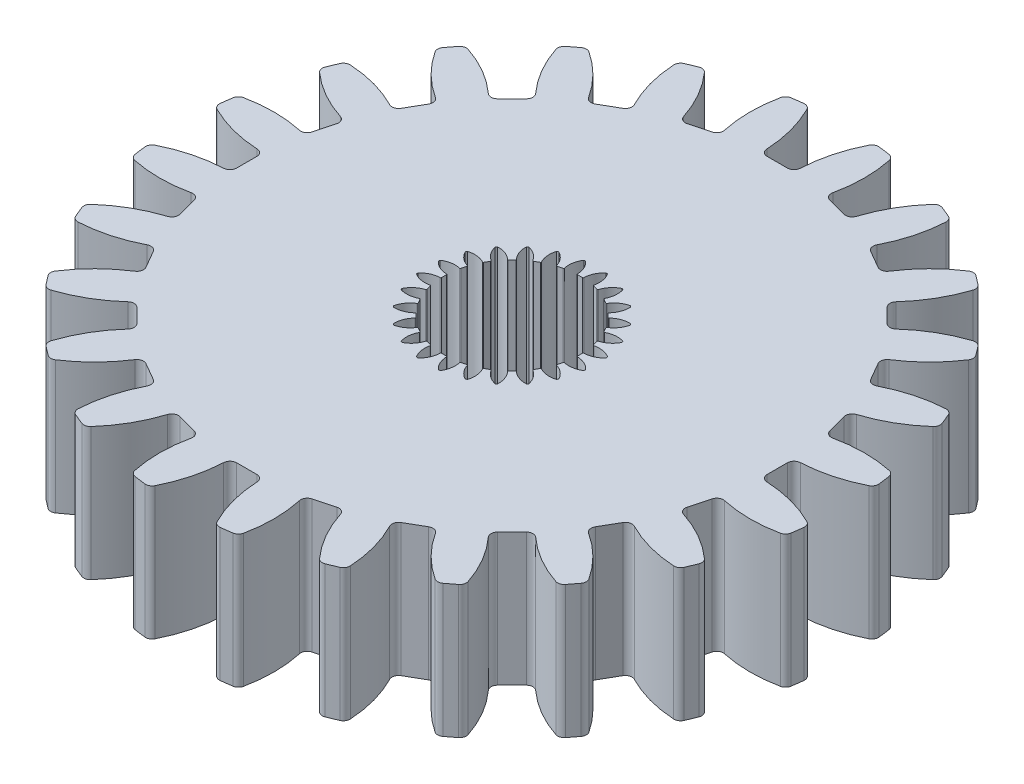
from build123d import *

# Parameters (mm, degrees)
SKETCH1_R                = 10
BOSS_EXTRUDE1_DEPTH      = 4
CUT_EXTRUDE1_START       = -10
CUT_EXTRUDE1_DEPTH       = 10
FILLET1_R                = 0.2
CIRPATTERN1_COUNT        = 24
FILLET1_OF_CIRPATTERN1_R = 0.2
SKETCH3_R                = 2.55
CUT_EXTRUDE2_DEPTH       = 10
BOSS_EXTRUDE2_DEPTH      = 4
CIRPATTERN2_DEPTH        = 4


# Read off the part's stored shape, not the designer's step: CirPattern2
with BuildPart() as part:
    # Sketch1 → Boss-Extrude1 (new body)
    with BuildSketch(Plane(origin=(0, 0, 0), x_dir=(1, 0, 0), z_dir=(0, 1, 0))):
        with Locations(Location((0, 0, 0), (0, 0, 270))):
            Circle(SKETCH1_R)
    extrude(amount=BOSS_EXTRUDE1_DEPTH)

    # Sketch2 → Cut-Extrude1 (cut)
    with BuildSketch(Plane(origin=(0, 4, 0), x_dir=(1, 0, 0), z_dir=(0, 1, 0)).offset(CUT_EXTRUDE1_START)):
        with BuildLine():
            Line((0.5, 8), (-0.5, 8))
            ThreePointArc((-0.5, 8), (-0.626989931, 9.006480261), (-1, 9.949874371))
            ThreePointArc((-1, 9.949874371), (0, 10), (1, 9.949874371))
            ThreePointArc((1, 9.949874371), (0.626989931, 9.006480261), (0.5, 8))
        make_face()
    cut_extrude1 = extrude(amount=CUT_EXTRUDE1_DEPTH, mode=Mode.SUBTRACT)

    # Fillet1
    fillet1_edges = [part.edges().sort_by_distance(p)[0] for p in [
        (1, 2, -9.949874371),
        (-1, 2, -9.949874371),
        (-0.5, 2, -8),
        (0.5, 2, -8),
    ]]
    fillet(fillet1_edges, radius=FILLET1_R)

    # CirPattern1: Cut-Extrude1 ×24 about axis
    cirpattern1_axis = Axis((0, 0, 0), (0, 1, 0))
    for i in range(1, CIRPATTERN1_COUNT):
        add(cut_extrude1.rotate(cirpattern1_axis, i * 360 / CIRPATTERN1_COUNT), mode=Mode.SUBTRACT)

    # Fillet1 of CirPattern1
    fillet1_of_cirpattern1_edges = [part.edges().sort_by_distance(p)[0] for p in [
        (-1.609291157, 2, -9.869659668),
        (-3.54114281, 2, -9.352021578),
        (-2.553515274, 2, -7.597997088),
        (-1.587589448, 2, -7.856816133),
        (-4.108911782, 2, -9.11684397),
        (-5.840962589, 2, -8.11684397),
        (-4.433012702, 2, -6.67820323),
        (-3.566987298, 2, -7.17820323),
        (-6.328516859, 2, -7.742730421),
        (-7.742730421, 2, -6.328516859),
        (-6.01040764, 2, -5.303300859),
        (-5.303300859, 2, -6.01040764),
        (-8.11684397, 2, -5.840962589),
        (-9.11684397, 2, -4.108911782),
        (-7.17820323, 2, -3.566987298),
        (-6.67820323, 2, -4.433012702),
        (-9.352021578, 2, -3.54114281),
        (-9.869659668, 2, -1.609291157),
        (-7.856816133, 2, -1.587589448),
        (-7.597997088, 2, -2.553515274),
        (-9.949874371, 2, -1),
        (-9.949874371, 2, 1),
        (-8, 2, 0.5),
        (-8, 2, -0.5),
        (-9.869659668, 2, 1.609291157),
        (-9.352021578, 2, 3.54114281),
        (-7.597997088, 2, 2.553515274),
        (-7.856816133, 2, 1.587589448),
        (-9.11684397, 2, 4.108911782),
        (-8.11684397, 2, 5.840962589),
        (-6.67820323, 2, 4.433012702),
        (-7.17820323, 2, 3.566987298),
        (-7.742730421, 2, 6.328516859),
        (-6.328516859, 2, 7.742730421),
        (-5.303300859, 2, 6.01040764),
        (-6.01040764, 2, 5.303300859),
        (-5.840962589, 2, 8.11684397),
        (-4.108911782, 2, 9.11684397),
        (-3.566987298, 2, 7.17820323),
        (-4.433012702, 2, 6.67820323),
        (-3.54114281, 2, 9.352021578),
        (-1.609291157, 2, 9.869659668),
        (-1.587589448, 2, 7.856816133),
        (-2.553515274, 2, 7.597997088),
        (-1, 2, 9.949874371),
        (1, 2, 9.949874371),
        (0.5, 2, 8),
        (-0.5, 2, 8),
        (1.609291157, 2, 9.869659668),
        (3.54114281, 2, 9.352021578),
        (2.553515274, 2, 7.597997088),
        (1.587589448, 2, 7.856816133),
        (4.108911782, 2, 9.11684397),
        (5.840962589, 2, 8.11684397),
        (4.433012702, 2, 6.67820323),
        (3.566987298, 2, 7.17820323),
        (6.328516859, 2, 7.742730421),
        (7.742730421, 2, 6.328516859),
        (6.01040764, 2, 5.303300859),
        (5.303300859, 2, 6.01040764),
        (8.11684397, 2, 5.840962589),
        (9.11684397, 2, 4.108911782),
        (7.17820323, 2, 3.566987298),
        (6.67820323, 2, 4.433012702),
        (9.352021578, 2, 3.54114281),
        (9.869659668, 2, 1.609291157),
        (7.856816133, 2, 1.587589448),
        (7.597997088, 2, 2.553515274),
        (9.949874371, 2, 1),
        (9.949874371, 2, -1),
        (8, 2, -0.5),
        (8, 2, 0.5),
        (9.869659668, 2, -1.609291157),
        (9.352021578, 2, -3.54114281),
        (7.597997088, 2, -2.553515274),
        (7.856816133, 2, -1.587589448),
        (9.11684397, 2, -4.108911782),
        (8.11684397, 2, -5.840962589),
        (6.67820323, 2, -4.433012702),
        (7.17820323, 2, -3.566987298),
        (7.742730421, 2, -6.328516859),
        (6.328516859, 2, -7.742730421),
        (5.303300859, 2, -6.01040764),
        (6.01040764, 2, -5.303300859),
        (5.840962589, 2, -8.11684397),
        (4.108911782, 2, -9.11684397),
        (3.566987298, 2, -7.17820323),
        (4.433012702, 2, -6.67820323),
        (3.54114281, 2, -9.352021578),
        (1.609291157, 2, -9.869659668),
        (1.587589448, 2, -7.856816133),
        (2.553515274, 2, -7.597997088),
    ]]
    fillet(fillet1_of_cirpattern1_edges, radius=FILLET1_OF_CIRPATTERN1_R)

    # Sketch3 → Cut-Extrude2 (cut)
    with BuildSketch(Plane(origin=(0, 4, 0), x_dir=(1, 0, 0), z_dir=(0, 1, 0))):
        with Locations(Location((0, 0, 0), (0, 0, 270))):
            Circle(SKETCH3_R)
    extrude(amount=-CUT_EXTRUDE2_DEPTH, mode=Mode.SUBTRACT)

    # Sketch4 → Boss-Extrude2 (add)
    with BuildSketch(Plane(origin=(0, 4, 0), x_dir=(1, 0, 0), z_dir=(0, 1, 0))):
        with BuildLine():
            Line((0, 2.55), (0, 2.05))
            Line((0, 2.05), (0.075298574, 2.05))
            ThreePointArc((0.075298574, 2.05), (0.089228034, 2.05564834), (0.095289661, 2.069402985))
            ThreePointArc((0.095289661, 2.069402985), (0.154666528, 2.322041158), (0.308149758, 2.531312649))
            ThreePointArc((0.308149758, 2.531312649), (0.154357937, 2.545323875), (0, 2.55))
        make_face()
        with BuildLine():
            Line((-0.075298574, 2.05), (0, 2.05))
            Line((0, 2.05), (0, 2.55))
            ThreePointArc((0, 2.55), (-0.154357937, 2.545323875), (-0.308149758, 2.531312649))
            ThreePointArc((-0.308149758, 2.531312649), (-0.154666528, 2.322041158), (-0.095289661, 2.069402985))
            ThreePointArc((-0.095289661, 2.069402985), (-0.089228034, 2.05564834), (-0.075298574, 2.05))
        make_face()
    extrude(amount=-BOSS_EXTRUDE2_DEPTH)

    # CirPattern2 outline → CirPattern2 (add)
    with BuildSketch(Plane(origin=(0, 0, 0), x_dir=(1, 0, 0), z_dir=(0, 1, 0))):
        with BuildLine():
            ThreePointArc((0.627643649, 1.974227009), (0.750384869, 2.202888881), (0.952801732, 2.365305236))
            ThreePointArc((0.952801732, 2.365305236), (0.659988565, 2.463110857), (0.357502113, 2.524815288))
            ThreePointArc((0.357502113, 2.524815288), (0.451592081, 2.282950167), (0.44355816, 2.023552567))
            ThreePointArc((0.44355816, 2.023552567), (0.445853278, 2.008697736), (0.457846205, 1.999636649))
            Line((0.457846205, 1.999636649), (0.60331188, 1.960659239))
            ThreePointArc((0.60331188, 1.960659239), (0.618228603, 1.962509907), (0.627643649, 1.974227009))
        make_face()
        with BuildLine():
            ThreePointArc((1.11722476, 1.744510725), (1.294965721, 1.933613368), (1.532521843, 2.03810618))
            ThreePointArc((1.532521843, 2.03810618), (1.275, 2.20836478), (0.998790806, 2.346255938))
            ThreePointArc((0.998790806, 2.346255938), (1.027075437, 2.088279895), (0.952178225, 1.839800386))
            ThreePointArc((0.952178225, 1.839800386), (0.950550426, 1.8248577), (0.959789522, 1.813001365))
            Line((0.959789522, 1.813001365), (1.090210478, 1.737702791))
            ThreePointArc((1.090210478, 1.737702791), (1.105097914, 1.735629667), (1.11722476, 1.744510725))
        make_face()
        with BuildLine():
            ThreePointArc((1.530668849, 1.395908918), (1.7512968, 1.532565298), (2.007803123, 1.572013556))
            ThreePointArc((2.007803123, 1.572013556), (1.803122292, 1.803122292), (1.572013556, 2.007803123))
            ThreePointArc((1.572013556, 2.007803123), (1.532565298, 1.7512968), (1.395908918, 1.530668849))
            ThreePointArc((1.395908918, 1.530668849), (1.390469133, 1.516656629), (1.396324769, 1.502813034))
            Line((1.396324769, 1.502813034), (1.502813034, 1.396324769))
            ThreePointArc((1.502813034, 1.396324769), (1.516656629, 1.390469133), (1.530668849, 1.395908918))
        make_face()
        with BuildLine():
            ThreePointArc((1.839800386, 0.952178225), (2.088279895, 1.027075437), (2.346255938, 0.998790806))
            ThreePointArc((2.346255938, 0.998790806), (2.20836478, 1.275), (2.03810618, 1.532521843))
            ThreePointArc((2.03810618, 1.532521843), (1.933613368, 1.294965721), (1.744510725, 1.11722476))
            ThreePointArc((1.744510725, 1.11722476), (1.735629667, 1.105097914), (1.737702791, 1.090210478))
            Line((1.737702791, 1.090210478), (1.813001365, 0.959789522))
            ThreePointArc((1.813001365, 0.959789522), (1.8248577, 0.950550426), (1.839800386, 0.952178225))
        make_face()
        with BuildLine():
            ThreePointArc((2.023552567, 0.44355816), (2.282950167, 0.451592081), (2.524815288, 0.357502113))
            ThreePointArc((2.524815288, 0.357502113), (2.463110857, 0.659988565), (2.365305236, 0.952801732))
            ThreePointArc((2.365305236, 0.952801732), (2.202888881, 0.750384869), (1.974227009, 0.627643649))
            ThreePointArc((1.974227009, 0.627643649), (1.962509907, 0.618228603), (1.960659239, 0.60331188))
            Line((1.960659239, 0.60331188), (1.999636649, 0.457846205))
            ThreePointArc((1.999636649, 0.457846205), (2.008697736, 0.445853278), (2.023552567, 0.44355816))
        make_face()
        with BuildLine():
            ThreePointArc((2.069402985, -0.095289661), (2.322041158, -0.154666528), (2.531312649, -0.308149758))
            ThreePointArc((2.531312649, -0.308149758), (2.55, 0), (2.531312649, 0.308149758))
            ThreePointArc((2.531312649, 0.308149758), (2.322041158, 0.154666528), (2.069402985, 0.095289661))
            ThreePointArc((2.069402985, 0.095289661), (2.05564834, 0.089228034), (2.05, 0.075298574))
            Line((2.05, 0.075298574), (2.05, -0.075298574))
            ThreePointArc((2.05, -0.075298574), (2.05564834, -0.089228034), (2.069402985, -0.095289661))
        make_face()
        with BuildLine():
            ThreePointArc((1.974227009, -0.627643649), (2.202888881, -0.750384869), (2.365305236, -0.952801732))
            ThreePointArc((2.365305236, -0.952801732), (2.463110857, -0.659988565), (2.524815288, -0.357502113))
            ThreePointArc((2.524815288, -0.357502113), (2.282950167, -0.451592081), (2.023552567, -0.44355816))
            ThreePointArc((2.023552567, -0.44355816), (2.008697736, -0.445853278), (1.999636649, -0.457846205))
            Line((1.999636649, -0.457846205), (1.960659239, -0.60331188))
            ThreePointArc((1.960659239, -0.60331188), (1.962509907, -0.618228603), (1.974227009, -0.627643649))
        make_face()
        with BuildLine():
            ThreePointArc((1.744510725, -1.11722476), (1.933613368, -1.294965721), (2.03810618, -1.532521843))
            ThreePointArc((2.03810618, -1.532521843), (2.20836478, -1.275), (2.346255938, -0.998790806))
            ThreePointArc((2.346255938, -0.998790806), (2.088279895, -1.027075437), (1.839800386, -0.952178225))
            ThreePointArc((1.839800386, -0.952178225), (1.8248577, -0.950550426), (1.813001365, -0.959789522))
            Line((1.813001365, -0.959789522), (1.737702791, -1.090210478))
            ThreePointArc((1.737702791, -1.090210478), (1.735629667, -1.105097914), (1.744510725, -1.11722476))
        make_face()
        with BuildLine():
            ThreePointArc((1.395908918, -1.530668849), (1.532565298, -1.7512968), (1.572013556, -2.007803123))
            ThreePointArc((1.572013556, -2.007803123), (1.803122292, -1.803122292), (2.007803123, -1.572013556))
            ThreePointArc((2.007803123, -1.572013556), (1.7512968, -1.532565298), (1.530668849, -1.395908918))
            ThreePointArc((1.530668849, -1.395908918), (1.516656629, -1.390469133), (1.502813034, -1.396324769))
            Line((1.502813034, -1.396324769), (1.396324769, -1.502813034))
            ThreePointArc((1.396324769, -1.502813034), (1.390469133, -1.516656629), (1.395908918, -1.530668849))
        make_face()
        with BuildLine():
            ThreePointArc((0.952178225, -1.839800386), (1.027075437, -2.088279895), (0.998790806, -2.346255938))
            ThreePointArc((0.998790806, -2.346255938), (1.275, -2.20836478), (1.532521843, -2.03810618))
            ThreePointArc((1.532521843, -2.03810618), (1.294965721, -1.933613368), (1.11722476, -1.744510725))
            ThreePointArc((1.11722476, -1.744510725), (1.105097914, -1.735629667), (1.090210478, -1.737702791))
            Line((1.090210478, -1.737702791), (0.959789522, -1.813001365))
            ThreePointArc((0.959789522, -1.813001365), (0.950550426, -1.8248577), (0.952178225, -1.839800386))
        make_face()
        with BuildLine():
            ThreePointArc((0.44355816, -2.023552567), (0.451592081, -2.282950167), (0.357502113, -2.524815288))
            ThreePointArc((0.357502113, -2.524815288), (0.659988565, -2.463110857), (0.952801732, -2.365305236))
            ThreePointArc((0.952801732, -2.365305236), (0.750384869, -2.202888881), (0.627643649, -1.974227009))
            ThreePointArc((0.627643649, -1.974227009), (0.618228603, -1.962509907), (0.60331188, -1.960659239))
            Line((0.60331188, -1.960659239), (0.457846205, -1.999636649))
            ThreePointArc((0.457846205, -1.999636649), (0.445853278, -2.008697736), (0.44355816, -2.023552567))
        make_face()
        with BuildLine():
            ThreePointArc((-0.095289661, -2.069402985), (-0.154666528, -2.322041158), (-0.308149758, -2.531312649))
            ThreePointArc((-0.308149758, -2.531312649), (0, -2.55), (0.308149758, -2.531312649))
            ThreePointArc((0.308149758, -2.531312649), (0.154666528, -2.322041158), (0.095289661, -2.069402985))
            ThreePointArc((0.095289661, -2.069402985), (0.089228034, -2.05564834), (0.075298574, -2.05))
            Line((0.075298574, -2.05), (-0.075298574, -2.05))
            ThreePointArc((-0.075298574, -2.05), (-0.089228034, -2.05564834), (-0.095289661, -2.069402985))
        make_face()
        with BuildLine():
            ThreePointArc((-0.627643649, -1.974227009), (-0.750384869, -2.202888881), (-0.952801732, -2.365305236))
            ThreePointArc((-0.952801732, -2.365305236), (-0.659988565, -2.463110857), (-0.357502113, -2.524815288))
            ThreePointArc((-0.357502113, -2.524815288), (-0.451592081, -2.282950167), (-0.44355816, -2.023552567))
            ThreePointArc((-0.44355816, -2.023552567), (-0.445853278, -2.008697736), (-0.457846205, -1.999636649))
            Line((-0.457846205, -1.999636649), (-0.60331188, -1.960659239))
            ThreePointArc((-0.60331188, -1.960659239), (-0.618228603, -1.962509907), (-0.627643649, -1.974227009))
        make_face()
        with BuildLine():
            ThreePointArc((-1.11722476, -1.744510725), (-1.294965721, -1.933613368), (-1.532521843, -2.03810618))
            ThreePointArc((-1.532521843, -2.03810618), (-1.275, -2.20836478), (-0.998790806, -2.346255938))
            ThreePointArc((-0.998790806, -2.346255938), (-1.027075437, -2.088279895), (-0.952178225, -1.839800386))
            ThreePointArc((-0.952178225, -1.839800386), (-0.950550426, -1.8248577), (-0.959789522, -1.813001365))
            Line((-0.959789522, -1.813001365), (-1.090210478, -1.737702791))
            ThreePointArc((-1.090210478, -1.737702791), (-1.105097914, -1.735629667), (-1.11722476, -1.744510725))
        make_face()
        with BuildLine():
            ThreePointArc((-1.530668849, -1.395908918), (-1.7512968, -1.532565298), (-2.007803123, -1.572013556))
            ThreePointArc((-2.007803123, -1.572013556), (-1.803122292, -1.803122292), (-1.572013556, -2.007803123))
            ThreePointArc((-1.572013556, -2.007803123), (-1.532565298, -1.7512968), (-1.395908918, -1.530668849))
            ThreePointArc((-1.395908918, -1.530668849), (-1.390469133, -1.516656629), (-1.396324769, -1.502813034))
            Line((-1.396324769, -1.502813034), (-1.502813034, -1.396324769))
            ThreePointArc((-1.502813034, -1.396324769), (-1.516656629, -1.390469133), (-1.530668849, -1.395908918))
        make_face()
        with BuildLine():
            ThreePointArc((-1.839800386, -0.952178225), (-2.088279895, -1.027075437), (-2.346255938, -0.998790806))
            ThreePointArc((-2.346255938, -0.998790806), (-2.20836478, -1.275), (-2.03810618, -1.532521843))
            ThreePointArc((-2.03810618, -1.532521843), (-1.933613368, -1.294965721), (-1.744510725, -1.11722476))
            ThreePointArc((-1.744510725, -1.11722476), (-1.735629667, -1.105097914), (-1.737702791, -1.090210478))
            Line((-1.737702791, -1.090210478), (-1.813001365, -0.959789522))
            ThreePointArc((-1.813001365, -0.959789522), (-1.8248577, -0.950550426), (-1.839800386, -0.952178225))
        make_face()
        with BuildLine():
            ThreePointArc((-2.023552567, -0.44355816), (-2.282950167, -0.451592081), (-2.524815288, -0.357502113))
            ThreePointArc((-2.524815288, -0.357502113), (-2.463110857, -0.659988565), (-2.365305236, -0.952801732))
            ThreePointArc((-2.365305236, -0.952801732), (-2.202888881, -0.750384869), (-1.974227009, -0.627643649))
            ThreePointArc((-1.974227009, -0.627643649), (-1.962509907, -0.618228603), (-1.960659239, -0.60331188))
            Line((-1.960659239, -0.60331188), (-1.999636649, -0.457846205))
            ThreePointArc((-1.999636649, -0.457846205), (-2.008697736, -0.445853278), (-2.023552567, -0.44355816))
        make_face()
        with BuildLine():
            ThreePointArc((-2.069402985, 0.095289661), (-2.322041158, 0.154666528), (-2.531312649, 0.308149758))
            ThreePointArc((-2.531312649, 0.308149758), (-2.55, 0), (-2.531312649, -0.308149758))
            ThreePointArc((-2.531312649, -0.308149758), (-2.322041158, -0.154666528), (-2.069402985, -0.095289661))
            ThreePointArc((-2.069402985, -0.095289661), (-2.05564834, -0.089228034), (-2.05, -0.075298574))
            Line((-2.05, -0.075298574), (-2.05, 0.075298574))
            ThreePointArc((-2.05, 0.075298574), (-2.05564834, 0.089228034), (-2.069402985, 0.095289661))
        make_face()
        with BuildLine():
            ThreePointArc((-1.974227009, 0.627643649), (-2.202888881, 0.750384869), (-2.365305236, 0.952801732))
            ThreePointArc((-2.365305236, 0.952801732), (-2.463110857, 0.659988565), (-2.524815288, 0.357502113))
            ThreePointArc((-2.524815288, 0.357502113), (-2.282950167, 0.451592081), (-2.023552567, 0.44355816))
            ThreePointArc((-2.023552567, 0.44355816), (-2.008697736, 0.445853278), (-1.999636649, 0.457846205))
            Line((-1.999636649, 0.457846205), (-1.960659239, 0.60331188))
            ThreePointArc((-1.960659239, 0.60331188), (-1.962509907, 0.618228603), (-1.974227009, 0.627643649))
        make_face()
        with BuildLine():
            ThreePointArc((-1.744510725, 1.11722476), (-1.933613368, 1.294965721), (-2.03810618, 1.532521843))
            ThreePointArc((-2.03810618, 1.532521843), (-2.20836478, 1.275), (-2.346255938, 0.998790806))
            ThreePointArc((-2.346255938, 0.998790806), (-2.088279895, 1.027075437), (-1.839800386, 0.952178225))
            ThreePointArc((-1.839800386, 0.952178225), (-1.8248577, 0.950550426), (-1.813001365, 0.959789522))
            Line((-1.813001365, 0.959789522), (-1.737702791, 1.090210478))
            ThreePointArc((-1.737702791, 1.090210478), (-1.735629667, 1.105097914), (-1.744510725, 1.11722476))
        make_face()
        with BuildLine():
            ThreePointArc((-1.395908918, 1.530668849), (-1.532565298, 1.7512968), (-1.572013556, 2.007803123))
            ThreePointArc((-1.572013556, 2.007803123), (-1.803122292, 1.803122292), (-2.007803123, 1.572013556))
            ThreePointArc((-2.007803123, 1.572013556), (-1.7512968, 1.532565298), (-1.530668849, 1.395908918))
            ThreePointArc((-1.530668849, 1.395908918), (-1.516656629, 1.390469133), (-1.502813034, 1.396324769))
            Line((-1.502813034, 1.396324769), (-1.396324769, 1.502813034))
            ThreePointArc((-1.396324769, 1.502813034), (-1.390469133, 1.516656629), (-1.395908918, 1.530668849))
        make_face()
        with BuildLine():
            ThreePointArc((-0.952178225, 1.839800386), (-1.027075437, 2.088279895), (-0.998790806, 2.346255938))
            ThreePointArc((-0.998790806, 2.346255938), (-1.275, 2.20836478), (-1.532521843, 2.03810618))
            ThreePointArc((-1.532521843, 2.03810618), (-1.294965721, 1.933613368), (-1.11722476, 1.744510725))
            ThreePointArc((-1.11722476, 1.744510725), (-1.105097914, 1.735629667), (-1.090210478, 1.737702791))
            Line((-1.090210478, 1.737702791), (-0.959789522, 1.813001365))
            ThreePointArc((-0.959789522, 1.813001365), (-0.950550426, 1.8248577), (-0.952178225, 1.839800386))
        make_face()
        with BuildLine():
            ThreePointArc((-0.44355816, 2.023552567), (-0.451592081, 2.282950167), (-0.357502113, 2.524815288))
            ThreePointArc((-0.357502113, 2.524815288), (-0.659988565, 2.463110857), (-0.952801732, 2.365305236))
            ThreePointArc((-0.952801732, 2.365305236), (-0.750384869, 2.202888881), (-0.627643649, 1.974227009))
            ThreePointArc((-0.627643649, 1.974227009), (-0.618228603, 1.962509907), (-0.60331188, 1.960659239))
            Line((-0.60331188, 1.960659239), (-0.457846205, 1.999636649))
            ThreePointArc((-0.457846205, 1.999636649), (-0.445853278, 2.008697736), (-0.44355816, 2.023552567))
        make_face()
    extrude(amount=CIRPATTERN2_DEPTH)


solid = part.part
